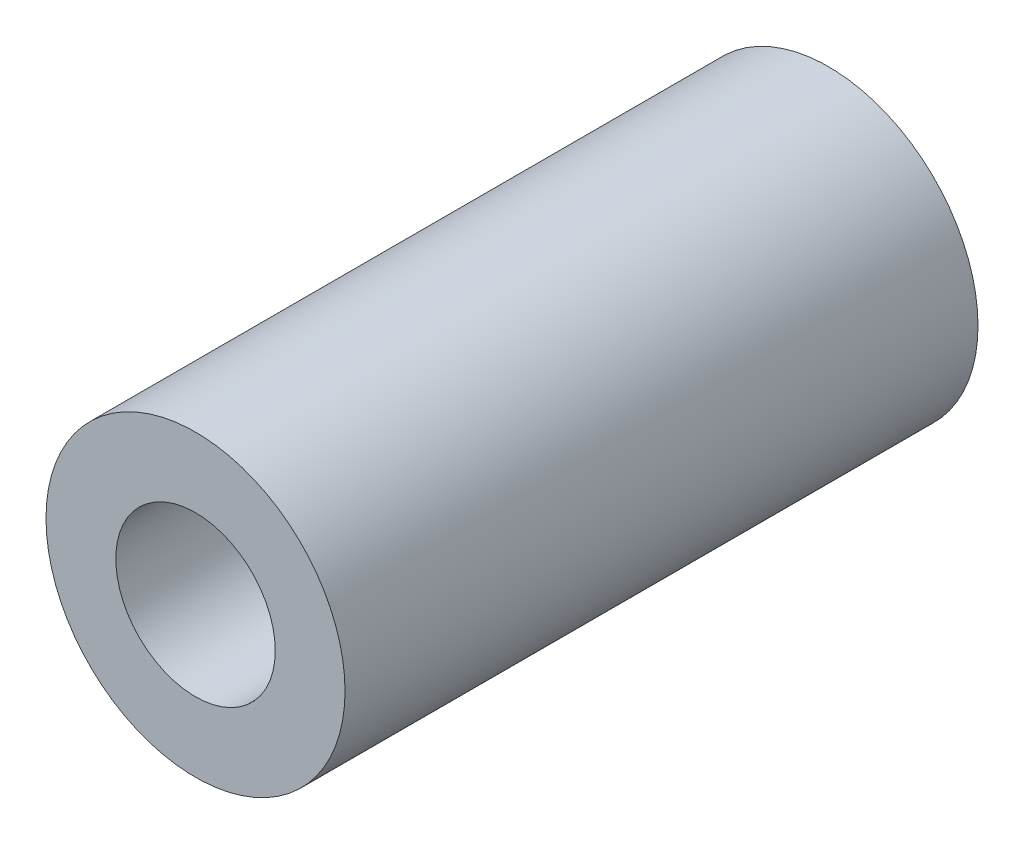
from build123d import *

# Parameters (mm, degrees)
SKETCH1_R      = 3
SKETCH1_R_2    = 1.6
EXTRUDE1_DEPTH = 6.35


with BuildPart() as part:
    # Sketch1 → Extrude1 (new, symmetric)
    with BuildSketch(Plane.XY):
        Circle(SKETCH1_R)
        Circle(SKETCH1_R_2, mode=Mode.SUBTRACT)
    extrude(amount=EXTRUDE1_DEPTH, both=True)


solid = part.part
